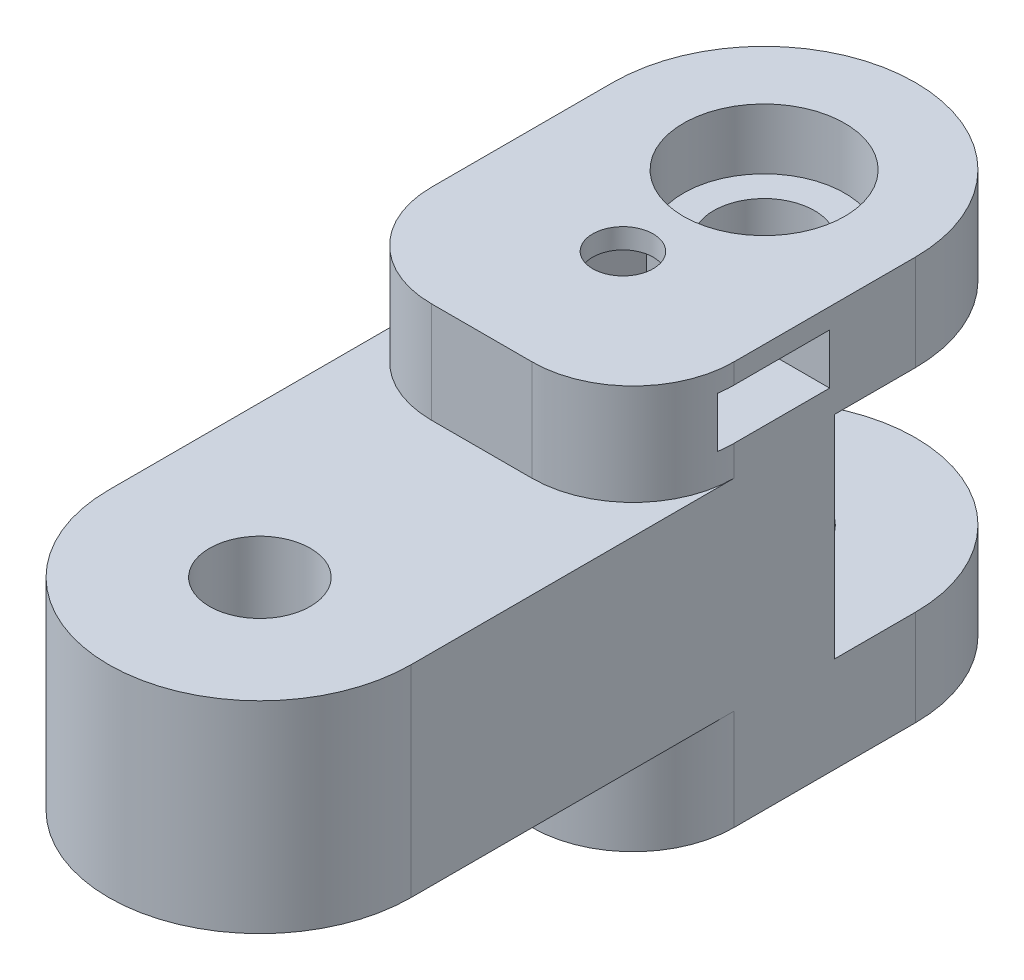
from build123d import *

# Parameters (mm, degrees)
SKETCH1_W           = 15
SKETCH1_H           = 20
BOSS_EXTRUDE1_DEPTH = 20
FILLET1_R           = 7.5
CUT_EXTRUDE1_START  = -4.75
SKETCH3_R           = 8.5
CUT_EXTRUDE1_DEPTH  = 10.5
SKETCH4_R           = 2.5
CUT_EXTRUDE2_DEPTH  = 30.261749777
CUT_EXTRUDE3_DEPTH  = 3
SKETCH6_R           = 4
CUT_EXTRUDE4_DEPTH  = 3
CUT_EXTRUDE5_DEPTH  = 30.261749777
SKETCH8_R           = 8.5
CUT_EXTRUDE6_DEPTH  = 5
SKETCH9_R           = 2.5
CUT_EXTRUDE7_DEPTH  = 27.100766272
CUT_EXTRUDE8_START  = -1
CUT_EXTRUDE8_DEPTH  = 2.5
SKETCH11_R          = 1.5
CUT_EXTRUDE9_DEPTH  = 10
SKETCH12_W          = 15
SKETCH12_H          = 7
CUT_EXTRUDE10_DEPTH = 5
SKETCH13_W          = 15
SKETCH13_H          = 7
CUT_EXTRUDE11_DEPTH = 5
FILLET2_R           = 5


# Some blends are built 0.0001 mm under size
with BuildPart() as part:
    # Sketch1 → Boss-Extrude1 (new, symmetric)
    with BuildSketch(Plane.XY):
        Rectangle(SKETCH1_W, SKETCH1_H)
    extrude(amount=BOSS_EXTRUDE1_DEPTH, both=True)

    # Fillet1
    fillet1_edges = [part.edges().sort_by_distance(p)[0] for p in [
        (-7.5, 0, -20),
        (7.5, 0, -20),
    ]]
    fillet(fillet1_edges, radius=FILLET1_R - 0.0001)  # a hair under: the kernel refuses the full size

    # Sketch3 → Cut-Extrude1 (cut)
    with BuildSketch(Plane(origin=(0, 10, 0), x_dir=(1, 0, 0), z_dir=(0, 1, 0)).offset(CUT_EXTRUDE1_START)):
        with Locations((0, 12.5)):
            Circle(SKETCH3_R)
    extrude(amount=-CUT_EXTRUDE1_DEPTH, mode=Mode.SUBTRACT)

    # Sketch4 → Cut-Extrude2 (cut, through all)
    with BuildSketch(Plane(origin=(0, 10, 0), x_dir=(1, 0, 0), z_dir=(0, 1, 0))):
        with Locations(Location((0, 12.5, 0), (0, 0, 270))):
            Circle(SKETCH4_R)
    extrude(amount=-CUT_EXTRUDE2_DEPTH, mode=Mode.SUBTRACT)

    # Sketch5 → Cut-Extrude3 (cut)
    with BuildSketch(Plane(origin=(0, -10, 0), x_dir=(-1, 0, 0), z_dir=(0, -1, 0))):
        Polygon((-2.020725942, 16), (-4.041451884, 12.5), (-2.020725942, 9), (2.020725942, 9), (4.041451884, 12.5), (2.020725942, 16), align=None)
    extrude(amount=-CUT_EXTRUDE3_DEPTH, mode=Mode.SUBTRACT)

    # Sketch6 → Cut-Extrude4 (cut)
    with BuildSketch(Plane(origin=(0, 10, 0), x_dir=(1, 0, 0), z_dir=(0, 1, 0))):
        with Locations(Location((0, 12.5, 0), (0, 0, 270))):
            Circle(SKETCH6_R)
    extrude(amount=-CUT_EXTRUDE4_DEPTH, mode=Mode.SUBTRACT)

    # Sketch7 → Cut-Extrude5 (cut, through all)
    with BuildSketch(Plane.XZ.offset(10)):
        with BuildLine():
            Line((-7.5, 12.5), (-7.5, 22.5))
            Line((-7.5, 22.5), (7.5, 22.5))
            Line((7.5, 22.5), (7.5, 12.5))
            ThreePointArc((7.5, 12.5), (0, 20), (-7.5, 12.5))
        make_face()
    extrude(amount=-CUT_EXTRUDE5_DEPTH, mode=Mode.SUBTRACT)

    # Sketch8 → Cut-Extrude6 (cut)
    with BuildSketch(Plane.XZ.offset(10)):
        with Locations((0, 12.5)):
            Circle(SKETCH8_R)
    cut_extrude6 = extrude(amount=-CUT_EXTRUDE6_DEPTH, mode=Mode.SUBTRACT)

    # Mirror3: Cut-Extrude6 across plane
    add(cut_extrude6.mirror(Plane.ZX), mode=Mode.SUBTRACT)

    # Sketch9 → Cut-Extrude7 (cut, through all)
    with BuildSketch(Plane.XZ.offset(5)):
        with Locations(Location((0, 12.5, 0), (0, 0, 270))):
            Circle(SKETCH9_R)
    extrude(amount=-CUT_EXTRUDE7_DEPTH, mode=Mode.SUBTRACT)

    # Sketch10 → Cut-Extrude8 (cut)
    with BuildSketch(Plane(origin=(0, 10, 0), x_dir=(1, 0, 0), z_dir=(0, 1, 0)).offset(CUT_EXTRUDE8_START)):
        Polygon((1.58771324, 2.75), (7.5, 2.75), (7.5, 8.25), (1.58771324, 8.25), (-1.58771324, 8.25), (-3.175426481, 5.5), (-1.58771324, 2.75), align=None)
    extrude(amount=-CUT_EXTRUDE8_DEPTH, mode=Mode.SUBTRACT)

    # Sketch11 → Cut-Extrude9 (cut)
    with BuildSketch(Plane(origin=(0, 10, 0), x_dir=(1, 0, 0), z_dir=(0, 1, 0))):
        with Locations(Location((0, 5.5, 0), (0, 0, 270))):
            Circle(SKETCH11_R)
    extrude(amount=-CUT_EXTRUDE9_DEPTH, mode=Mode.SUBTRACT)

    # Sketch12 → Cut-Extrude10 (cut)
    with BuildSketch(Plane(origin=(0, 10, 0), x_dir=(1, 0, 0), z_dir=(0, 1, 0))):
        with Locations((0, -5)):
            Rectangle(SKETCH12_W, SKETCH12_H)
    extrude(amount=-CUT_EXTRUDE10_DEPTH, mode=Mode.SUBTRACT)

    # Sketch13 → Cut-Extrude11 (cut)
    with BuildSketch(Plane.XZ.offset(10)):
        with Locations((0, 5)):
            Rectangle(SKETCH13_W, SKETCH13_H)
    extrude(amount=-CUT_EXTRUDE11_DEPTH, mode=Mode.SUBTRACT)

    # Fillet2
    # the kernel refuses this fillet: 5 mm, written as the material it takes off along each edge
    with BuildSketch(Plane(origin=(-7.5, 22.5, 1.5), x_dir=(1, 0, 0), z_dir=(0, -1, 0)), Plane(origin=(7.5, -22.5, 1.5), x_dir=(-1, 0, 0), z_dir=(0, 1, 0)), Plane(origin=(-7.5, -22.5, 1.5), x_dir=(0, 0, -1), z_dir=(0, 1, 0))) as fillet2_piece_1:
        with BuildLine():
            CenterArc((FILLET2_R, -FILLET2_R), FILLET2_R, 90, 90)
            Line((0, -FILLET2_R), (0, 0))
            Line((0, 0), (FILLET2_R, 0))
        make_face()
    extrude(amount=17.5, mode=Mode.SUBTRACT)
    with BuildSketch(Plane(origin=(-7.5, 22.5, 1.5), x_dir=(1, 0, 0), z_dir=(0, -1, 0))) as fillet2_piece_2_section:
        with BuildLine():
            CenterArc((FILLET2_R, -FILLET2_R), FILLET2_R, 90, 90)
            Line((0, -FILLET2_R), (0, 0))
            Line((0, 0), (FILLET2_R, 0))
        make_face()
    fillet2_piece_2 = extrude(amount=30, mode=Mode.PRIVATE)
    fillet2_piece_2 = split(fillet2_piece_2, bisect_by=Plane(origin=(-6.368024429, -5, 0.368024429), z_dir=(0, -1, 0)), keep=Keep.TOP, mode=Mode.PRIVATE)
    add(fillet2_piece_2, mode=Mode.SUBTRACT)
    with BuildSketch(Plane(origin=(7.5, 22.5, 1.5), x_dir=(-1, 0, 0), z_dir=(0, -1, 0))) as fillet2_piece_3:
        with BuildLine():
            CenterArc((FILLET2_R, FILLET2_R), FILLET2_R, 180, 90)
            Line((0, FILLET2_R), (0, 0))
            Line((0, 0), (FILLET2_R, 0))
        make_face()
    extrude(amount=17.5, mode=Mode.SUBTRACT)
    with BuildSketch(Plane(origin=(7.5, 22.5, 1.5), x_dir=(-1, 0, 0), z_dir=(0, -1, 0))) as fillet2_piece_4_section:
        with BuildLine():
            CenterArc((FILLET2_R, FILLET2_R), FILLET2_R, 180, 90)
            Line((0, FILLET2_R), (0, 0))
            Line((0, 0), (FILLET2_R, 0))
        make_face()
    fillet2_piece_4 = extrude(amount=30, mode=Mode.PRIVATE)
    fillet2_piece_4 = split(fillet2_piece_4, bisect_by=Plane(origin=(6.368024429, -5, 0.368024429), z_dir=(0, -1, 0)), keep=Keep.TOP, mode=Mode.PRIVATE)
    add(fillet2_piece_4, mode=Mode.SUBTRACT)
    with BuildSketch(Plane(origin=(7.5, -22.5, 1.5), x_dir=(-1, 0, 0), z_dir=(0, 1, 0))) as fillet2_piece_5_section:
        with BuildLine():
            CenterArc((FILLET2_R, -FILLET2_R), FILLET2_R, 90, 90)
            Line((0, -FILLET2_R), (0, 0))
            Line((0, 0), (FILLET2_R, 0))
        make_face()
    fillet2_piece_5 = extrude(amount=30, mode=Mode.PRIVATE)
    fillet2_piece_5 = split(fillet2_piece_5, bisect_by=Plane(origin=(6.368024429, 5, 0.368024429), z_dir=(0, 1, 0)), keep=Keep.TOP, mode=Mode.PRIVATE)
    add(fillet2_piece_5, mode=Mode.SUBTRACT)
    with BuildSketch(Plane(origin=(-7.5, -22.5, 1.5), x_dir=(0, 0, -1), z_dir=(0, 1, 0))) as fillet2_piece_6_section:
        with BuildLine():
            CenterArc((FILLET2_R, -FILLET2_R), FILLET2_R, 90, 90)
            Line((0, -FILLET2_R), (0, 0))
            Line((0, 0), (FILLET2_R, 0))
        make_face()
    fillet2_piece_6 = extrude(amount=30, mode=Mode.PRIVATE)
    fillet2_piece_6 = split(fillet2_piece_6, bisect_by=Plane(origin=(-6.368024429, 5, 0.368024429), z_dir=(0, 1, 0)), keep=Keep.TOP, mode=Mode.PRIVATE)
    add(fillet2_piece_6, mode=Mode.SUBTRACT)


solid = part.part
